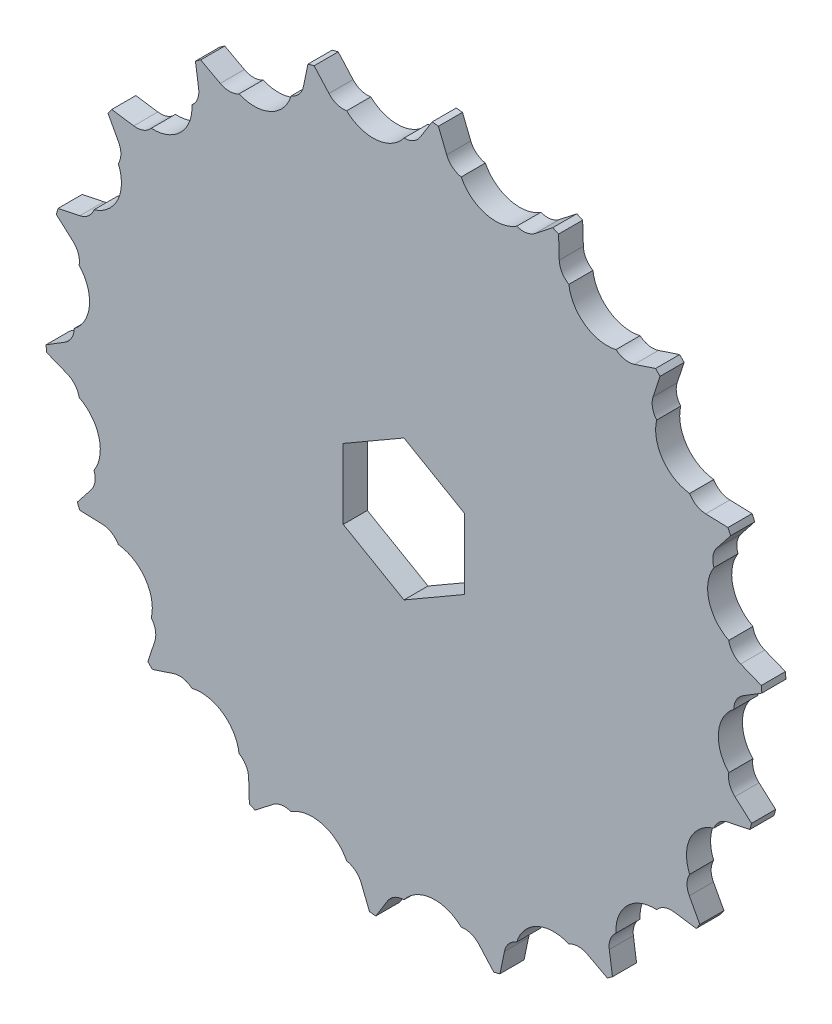
from build123d import *

# Parameters (mm, degrees)
BOSS_EXTRUDE1_DEPTH                 = 5
SKETCH2_R                           = 12.5
BOSS_EXTRUDE2_DEPTH                 = 40
CUT_EXTRUDE2_DEPTH                  = 10
SKETCH9_R                           = 100
SKETCH9_R_2                         = 74.5
CUT_EXTRUDE5_DEPTH                  = 10
FILLET1_R                           = 30
SKETCH3_R                           = 5
CUT_EXTRUDE1_DEPTH                  = 115.269213892
F_1_0MM_DOWEL_HOLE1_D               = 2.8
F_1_0MM_DOWEL_HOLE1_DEPTH           = 33.158795133
F_1_0MM_DOWEL_HOLE1_TIP             = 0.841204867
F_1_0MM_DOWEL_HOLE1_ON_FACE_2_D     = 2.8
F_1_0MM_DOWEL_HOLE1_ON_FACE_2_DEPTH = 33.158795133
F_1_0MM_DOWEL_HOLE1_ON_FACE_2_TIP   = 0.841204867
CIRPATTERN1_COUNT                   = 18
CUT_EXTRUDE3_DEPTH                  = 115.269213931
CUT_EXTRUDE3_DEPTH_BACK             = 115.269213931
SKETCH6_W                           = 154.176776301
SKETCH6_H                           = 45.916506966
CUT_EXTRUDE4_DEPTH                  = 106.154425696
CUT_EXTRUDE4_DEPTH_BACK             = 106.154425696


with BuildPart() as part:
    # Sketch1 → Boss-Extrude1 (new body)
    with BuildSketch(Plane.XY):
        with BuildLine():
            ThreePointArc((3.400646872, 70.34391338), (0, 68.45), (-3.400646872, 70.34391338))
            Line((-3.400646872, 70.34391338), (-6.085453124, 74.679004775))
            ThreePointArc((-6.085453124, 74.679004775), (-6.554111855, 74.913841296), (-6.974871672, 74.601190735))
            Line((-6.974871672, 74.601190735), (-8.866108963, 69.865747406))
            ThreePointArc((-8.866108963, 69.865747406), (-11.886217761, 67.410090694), (-15.564075773, 68.684715142))
            Line((-15.564075773, 68.684715142), (-18.960874506, 72.487735044))
            ThreePointArc((-18.960874506, 72.487735044), (-19.463192192, 72.637622137), (-19.823268522, 72.256657264))
            Line((-19.823268522, 72.256657264), (-20.863472565, 67.264746051))
            ThreePointArc((-20.863472565, 67.264746051), (-23.411278811, 64.321959893), (-27.254598108, 64.93856659))
            Line((-27.254598108, 64.93856659), (-31.260179312, 68.093962165))
            ThreePointArc((-31.260179312, 68.093962165), (-31.780893283, 68.154345585), (-32.069345388, 67.716641827))
            Line((-32.069345388, 67.716641827), (-32.226910109, 62.619939425))
            ThreePointArc((-32.226910109, 62.619939425), (-34.225, 59.279438889), (-38.117003271, 59.219292553))
            Line((-38.117003271, 59.219292553), (-42.609659387, 61.631188702))
            ThreePointArc((-42.609659387, 61.631188702), (-43.132948014, 61.600233731), (-43.341011423, 61.119090493))
            Line((-43.341011423, 61.119090493), (-42.611149298, 56.072457626))
            ThreePointArc((-42.611149298, 56.072457626), (-43.998811883, 52.435742131), (-47.821242577, 51.700670278))
            Line((-47.821242577, 51.700670278), (-52.664466523, 53.295782758))
            ThreePointArc((-52.664466523, 53.295782758), (-53.174429945, 53.174429945), (-53.295782758, 52.664466523))
            Line((-53.295782758, 52.664466523), (-51.700670278, 47.821242577))
            ThreePointArc((-51.700670278, 47.821242577), (-52.435742131, 43.998811883), (-56.072457626, 42.611149298))
            Line((-56.072457626, 42.611149298), (-61.119090493, 43.341011423))
            ThreePointArc((-61.119090493, 43.341011423), (-61.600233731, 43.132948014), (-61.631188702, 42.609659387))
            Line((-61.631188702, 42.609659387), (-59.219292553, 38.117003271))
            ThreePointArc((-59.219292553, 38.117003271), (-59.279438889, 34.225), (-62.619939425, 32.226910109))
            Line((-62.619939425, 32.226910109), (-67.716641827, 32.069345388))
            ThreePointArc((-67.716641827, 32.069345388), (-68.154345585, 31.780893283), (-68.093962165, 31.260179312))
            Line((-68.093962165, 31.260179312), (-64.93856659, 27.254598108))
            ThreePointArc((-64.93856659, 27.254598108), (-64.321959893, 23.411278811), (-67.264746051, 20.863472565))
            Line((-67.264746051, 20.863472565), (-72.256657264, 19.823268522))
            ThreePointArc((-72.256657264, 19.823268522), (-72.637622137, 19.463192192), (-72.487735044, 18.960874506))
            Line((-72.487735044, 18.960874506), (-68.684715142, 15.564075773))
            ThreePointArc((-68.684715142, 15.564075773), (-67.410090694, 11.886217761), (-69.865747406, 8.866108963))
            Line((-69.865747406, 8.866108963), (-74.601190735, 6.974871672))
            ThreePointArc((-74.601190735, 6.974871672), (-74.913841296, 6.554111855), (-74.679004775, 6.085453124))
            Line((-74.679004775, 6.085453124), (-70.34391338, 3.400646872))
            ThreePointArc((-70.34391338, 3.400646872), (-68.45, 0), (-70.34391338, -3.400646872))
            Line((-70.34391338, -3.400646872), (-74.679004775, -6.085453124))
            ThreePointArc((-74.679004775, -6.085453124), (-74.913841296, -6.554111855), (-74.601190735, -6.974871672))
            Line((-74.601190735, -6.974871672), (-69.865747406, -8.866108963))
            ThreePointArc((-69.865747406, -8.866108963), (-67.410090694, -11.886217761), (-68.684715142, -15.564075773))
            Line((-68.684715142, -15.564075773), (-72.487735044, -18.960874506))
            ThreePointArc((-72.487735044, -18.960874506), (-72.637622137, -19.463192192), (-72.256657264, -19.823268522))
            Line((-72.256657264, -19.823268522), (-67.264746051, -20.863472565))
            ThreePointArc((-67.264746051, -20.863472565), (-64.321959893, -23.411278811), (-64.93856659, -27.254598108))
            Line((-64.93856659, -27.254598108), (-68.093962165, -31.260179312))
            ThreePointArc((-68.093962165, -31.260179312), (-68.154345585, -31.780893283), (-67.716641827, -32.069345388))
            Line((-67.716641827, -32.069345388), (-62.619939425, -32.226910109))
            ThreePointArc((-62.619939425, -32.226910109), (-59.279438889, -34.225), (-59.219292553, -38.117003271))
            Line((-59.219292553, -38.117003271), (-61.631188702, -42.609659387))
            ThreePointArc((-61.631188702, -42.609659387), (-61.600233731, -43.132948014), (-61.119090493, -43.341011423))
            Line((-61.119090493, -43.341011423), (-56.072457626, -42.611149298))
            ThreePointArc((-56.072457626, -42.611149298), (-52.435742131, -43.998811883), (-51.700670278, -47.821242577))
            Line((-51.700670278, -47.821242577), (-53.295782758, -52.664466523))
            ThreePointArc((-53.295782758, -52.664466523), (-53.174429945, -53.174429945), (-52.664466523, -53.295782758))
            Line((-52.664466523, -53.295782758), (-47.821242577, -51.700670278))
            ThreePointArc((-47.821242577, -51.700670278), (-43.998811883, -52.435742131), (-42.611149298, -56.072457626))
            Line((-42.611149298, -56.072457626), (-43.341011423, -61.119090493))
            ThreePointArc((-43.341011423, -61.119090493), (-43.132948014, -61.600233731), (-42.609659387, -61.631188702))
            Line((-42.609659387, -61.631188702), (-38.117003271, -59.219292553))
            ThreePointArc((-38.117003271, -59.219292553), (-34.225, -59.279438889), (-32.226910109, -62.619939425))
            Line((-32.226910109, -62.619939425), (-32.069345388, -67.716641827))
            ThreePointArc((-32.069345388, -67.716641827), (-31.780893283, -68.154345585), (-31.260179312, -68.093962165))
            Line((-31.260179312, -68.093962165), (-27.254598108, -64.93856659))
            ThreePointArc((-27.254598108, -64.93856659), (-23.411278811, -64.321959893), (-20.863472565, -67.264746051))
            Line((-20.863472565, -67.264746051), (-19.823268522, -72.256657264))
            ThreePointArc((-19.823268522, -72.256657264), (-19.463192192, -72.637622137), (-18.960874506, -72.487735044))
            Line((-18.960874506, -72.487735044), (-15.564075773, -68.684715142))
            ThreePointArc((-15.564075773, -68.684715142), (-11.886217761, -67.410090694), (-8.866108963, -69.865747406))
            Line((-8.866108963, -69.865747406), (-6.974871672, -74.601190735))
            ThreePointArc((-6.974871672, -74.601190735), (-6.554111855, -74.913841296), (-6.085453124, -74.679004775))
            Line((-6.085453124, -74.679004775), (-3.400646872, -70.34391338))
            ThreePointArc((-3.400646872, -70.34391338), (0, -68.45), (3.400646872, -70.34391338))
            Line((3.400646872, -70.34391338), (6.085453124, -74.679004775))
            ThreePointArc((6.085453124, -74.679004775), (6.554111855, -74.913841296), (6.974871672, -74.601190735))
            Line((6.974871672, -74.601190735), (8.866108963, -69.865747406))
            ThreePointArc((8.866108963, -69.865747406), (11.886217761, -67.410090694), (15.564075773, -68.684715142))
            Line((15.564075773, -68.684715142), (18.960874506, -72.487735044))
            ThreePointArc((18.960874506, -72.487735044), (19.463192192, -72.637622137), (19.823268522, -72.256657264))
            Line((19.823268522, -72.256657264), (20.863472565, -67.264746051))
            ThreePointArc((20.863472565, -67.264746051), (23.411278811, -64.321959893), (27.254598108, -64.93856659))
            Line((27.254598108, -64.93856659), (31.260179312, -68.093962165))
            ThreePointArc((31.260179312, -68.093962165), (31.780893283, -68.154345585), (32.069345388, -67.716641827))
            Line((32.069345388, -67.716641827), (32.226910109, -62.619939425))
            ThreePointArc((32.226910109, -62.619939425), (34.225, -59.279438889), (38.117003271, -59.219292553))
            Line((38.117003271, -59.219292553), (42.609659387, -61.631188702))
            ThreePointArc((42.609659387, -61.631188702), (43.132948014, -61.600233731), (43.341011423, -61.119090493))
            Line((43.341011423, -61.119090493), (42.611149298, -56.072457626))
            ThreePointArc((42.611149298, -56.072457626), (43.998811883, -52.435742131), (47.821242577, -51.700670278))
            Line((47.821242577, -51.700670278), (52.664466523, -53.295782758))
            ThreePointArc((52.664466523, -53.295782758), (53.174429945, -53.174429945), (53.295782758, -52.664466523))
            Line((53.295782758, -52.664466523), (51.700670278, -47.821242577))
            ThreePointArc((51.700670278, -47.821242577), (52.435742131, -43.998811883), (56.072457626, -42.611149298))
            Line((56.072457626, -42.611149298), (61.119090493, -43.341011423))
            ThreePointArc((61.119090493, -43.341011423), (61.600233731, -43.132948014), (61.631188702, -42.609659387))
            Line((61.631188702, -42.609659387), (59.219292553, -38.117003271))
            ThreePointArc((59.219292553, -38.117003271), (59.279438889, -34.225), (62.619939425, -32.226910109))
            Line((62.619939425, -32.226910109), (67.716641827, -32.069345388))
            ThreePointArc((67.716641827, -32.069345388), (68.154345585, -31.780893283), (68.093962165, -31.260179312))
            Line((68.093962165, -31.260179312), (64.93856659, -27.254598108))
            ThreePointArc((64.93856659, -27.254598108), (64.321959893, -23.411278811), (67.264746051, -20.863472565))
            Line((67.264746051, -20.863472565), (72.256657264, -19.823268522))
            ThreePointArc((72.256657264, -19.823268522), (72.637622137, -19.463192192), (72.487735044, -18.960874506))
            Line((72.487735044, -18.960874506), (68.684715142, -15.564075773))
            ThreePointArc((68.684715142, -15.564075773), (67.410090694, -11.886217761), (69.865747406, -8.866108963))
            Line((69.865747406, -8.866108963), (74.601190735, -6.974871672))
            ThreePointArc((74.601190735, -6.974871672), (74.913841296, -6.554111855), (74.679004775, -6.085453124))
            Line((74.679004775, -6.085453124), (70.34391338, -3.400646872))
            ThreePointArc((70.34391338, -3.400646872), (68.45, 0), (70.34391338, 3.400646872))
            Line((70.34391338, 3.400646872), (74.679004775, 6.085453124))
            ThreePointArc((74.679004775, 6.085453124), (74.913841296, 6.554111855), (74.601190735, 6.974871672))
            Line((74.601190735, 6.974871672), (69.865747406, 8.866108963))
            ThreePointArc((69.865747406, 8.866108963), (67.410090694, 11.886217761), (68.684715142, 15.564075773))
            Line((68.684715142, 15.564075773), (72.487735044, 18.960874506))
            ThreePointArc((72.487735044, 18.960874506), (72.637622137, 19.463192192), (72.256657264, 19.823268522))
            Line((72.256657264, 19.823268522), (67.264746051, 20.863472565))
            ThreePointArc((67.264746051, 20.863472565), (64.321959893, 23.411278811), (64.93856659, 27.254598108))
            Line((64.93856659, 27.254598108), (68.093962165, 31.260179312))
            ThreePointArc((68.093962165, 31.260179312), (68.154345585, 31.780893283), (67.716641827, 32.069345388))
            Line((67.716641827, 32.069345388), (62.619939425, 32.226910109))
            ThreePointArc((62.619939425, 32.226910109), (59.279438889, 34.225), (59.219292553, 38.117003271))
            Line((59.219292553, 38.117003271), (61.631188702, 42.609659387))
            ThreePointArc((61.631188702, 42.609659387), (61.600233731, 43.132948014), (61.119090493, 43.341011423))
            Line((61.119090493, 43.341011423), (56.072457626, 42.611149298))
            ThreePointArc((56.072457626, 42.611149298), (52.435742131, 43.998811883), (51.700670278, 47.821242577))
            Line((51.700670278, 47.821242577), (53.295782758, 52.664466523))
            ThreePointArc((53.295782758, 52.664466523), (53.174429945, 53.174429945), (52.664466523, 53.295782758))
            Line((52.664466523, 53.295782758), (47.821242577, 51.700670278))
            ThreePointArc((47.821242577, 51.700670278), (43.998811883, 52.435742131), (42.611149298, 56.072457626))
            Line((42.611149298, 56.072457626), (43.341011423, 61.119090493))
            ThreePointArc((43.341011423, 61.119090493), (43.132948014, 61.600233731), (42.609659387, 61.631188702))
            Line((42.609659387, 61.631188702), (38.117003271, 59.219292553))
            ThreePointArc((38.117003271, 59.219292553), (34.225, 59.279438889), (32.226910109, 62.619939425))
            Line((32.226910109, 62.619939425), (32.069345388, 67.716641827))
            ThreePointArc((32.069345388, 67.716641827), (31.780893283, 68.154345585), (31.260179312, 68.093962165))
            Line((31.260179312, 68.093962165), (27.254598108, 64.93856659))
            ThreePointArc((27.254598108, 64.93856659), (23.411278811, 64.321959893), (20.863472565, 67.264746051))
            Line((20.863472565, 67.264746051), (19.823268522, 72.256657264))
            ThreePointArc((19.823268522, 72.256657264), (19.463192192, 72.637622137), (18.960874506, 72.487735044))
            Line((18.960874506, 72.487735044), (15.564075773, 68.684715142))
            ThreePointArc((15.564075773, 68.684715142), (11.886217761, 67.410090694), (8.866108963, 69.865747406))
            Line((8.866108963, 69.865747406), (6.974871672, 74.601190735))
            ThreePointArc((6.974871672, 74.601190735), (6.554111855, 74.913841296), (6.085453124, 74.679004775))
            Line((6.085453124, 74.679004775), (3.400646872, 70.34391338))
        make_face()
    extrude(amount=BOSS_EXTRUDE1_DEPTH)

    # Sketch2 → Boss-Extrude2 (add)
    with BuildSketch(Plane.XY.offset(5)):
        Circle(SKETCH2_R)
    extrude(amount=BOSS_EXTRUDE2_DEPTH)

    # Sketch5 → Cut-Extrude2 (cut)
    with BuildSketch(Plane(origin=(0, 0, 0), x_dir=(-1, 0, 0), z_dir=(0, 0, -1))):
        with BuildLine():
            Line((0, 68.45), (0.611002974, 75.43379595))
            Line((0.611002974, 75.43379595), (12.497220735, 74.393886643))
            Line((12.497220735, 74.393886643), (11.886217761, 67.410090694))
            ThreePointArc((11.886217761, 67.410090694), (5.710404715, 65.270224566), (0, 68.45))
        make_face()
    cut_extrude2 = extrude(amount=-CUT_EXTRUDE2_DEPTH, mode=Mode.SUBTRACT)

    # Sketch9 → Cut-Extrude5 (cut)
    with BuildSketch(Plane(origin=(0, 0, 0), x_dir=(-1, 0, 0), z_dir=(0, 0, -1))):
        Circle(SKETCH9_R)
        Circle(SKETCH9_R_2, mode=Mode.SUBTRACT)
    extrude(amount=-CUT_EXTRUDE5_DEPTH, mode=Mode.SUBTRACT)

    # Fillet1
    fillet1_edges = [part.edges().sort_by_distance(p)[0] for p in [
        (-12.5, 0, 5),
    ]]
    fillet(fillet1_edges, radius=FILLET1_R)

    # Sketch3 → Cut-Extrude1 (cut, through all)
    with BuildSketch(Plane.XY.offset(45)):
        Circle(SKETCH3_R)
    extrude(amount=-CUT_EXTRUDE1_DEPTH, mode=Mode.SUBTRACT)

    # Ø1.0mm Dowel Hole1
    with Locations(Plane(origin=(-6.81763654, -10.477109907, 42.020116055), x_dir=(-0.838168792578, 0.545410923202, 0), z_dir=(-0.545410923202, -0.838168792578, 0))):
        with Locations((0, 0)):
            Hole(F_1_0MM_DOWEL_HOLE1_D / 2, depth=F_1_0MM_DOWEL_HOLE1_DEPTH)
            with Locations((0, 0, -(F_1_0MM_DOWEL_HOLE1_DEPTH + F_1_0MM_DOWEL_HOLE1_TIP / 2))):  # 118° drill point
                Cone(0, F_1_0MM_DOWEL_HOLE1_D / 2, F_1_0MM_DOWEL_HOLE1_TIP, mode=Mode.SUBTRACT)

    # Ø1.0mm Dowel Hole1 on face 2
    with Locations(Plane(origin=(-11.068439798, 5.808583342, 41.658255729), x_dir=(-0.464687003812, -0.885475007264, 0), z_dir=(-0.885475007264, 0.464687003812, 0))):
        with Locations((0, 0)):
            Hole(F_1_0MM_DOWEL_HOLE1_ON_FACE_2_D / 2, depth=F_1_0MM_DOWEL_HOLE1_ON_FACE_2_DEPTH)
            with Locations((0, 0, -(F_1_0MM_DOWEL_HOLE1_ON_FACE_2_DEPTH + F_1_0MM_DOWEL_HOLE1_ON_FACE_2_TIP / 2))):  # 118° drill point
                Cone(0, F_1_0MM_DOWEL_HOLE1_ON_FACE_2_D / 2, F_1_0MM_DOWEL_HOLE1_ON_FACE_2_TIP, mode=Mode.SUBTRACT)

    # CirPattern1: Cut-Extrude2 ×18 about axis
    cirpattern1_axis = Axis((0, 0, 0), (0, 0, 1))
    for i in range(1, CIRPATTERN1_COUNT):
        add(cut_extrude2.rotate(cirpattern1_axis, i * 360 / CIRPATTERN1_COUNT), mode=Mode.SUBTRACT)

    # Sketch6 → Cut-Extrude3 (cut, two sides: drawn at the far end of the back side and taken through both)
    with BuildSketch(Plane(origin=(0, 0, 0), x_dir=(1, 0, 0), z_dir=(0, 1, 0)).offset(-CUT_EXTRUDE3_DEPTH_BACK)):
        with Locations((2.817083989, -27.958253483)):
            Rectangle(SKETCH6_W, SKETCH6_H)
    extrude(amount=CUT_EXTRUDE3_DEPTH + CUT_EXTRUDE3_DEPTH_BACK, mode=Mode.SUBTRACT)

    # Sketch7 → Cut-Extrude4 (cut, two sides: drawn at the far end of the back side and taken through both)
    with BuildSketch(Plane(origin=(0, 0, 0), x_dir=(-1, 0, 0), z_dir=(0, 0, -1)).offset(-CUT_EXTRUDE4_DEPTH_BACK)):
        Polygon((12.6, -7.274613392), (12.6, 7.274613392), (0, 14.549226784), (-12.6, 7.274613392), (-12.6, -7.274613392), (0, -14.549226784), align=None)
    extrude(amount=CUT_EXTRUDE4_DEPTH + CUT_EXTRUDE4_DEPTH_BACK, mode=Mode.SUBTRACT)


solid = part.part
